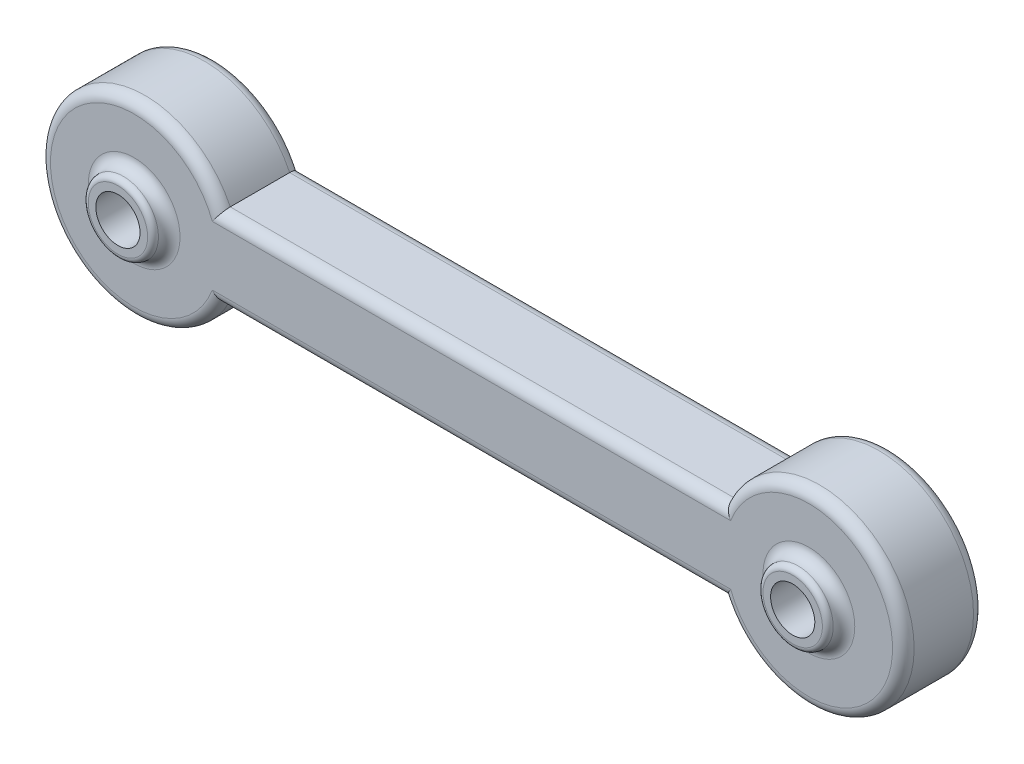
from build123d import *
from build123d.topology import SkipClean

# Parameters (mm, degrees)
SKETCH1_R            = 4.1
BOSS_EXTRUDE1_DEPTH  = 15
BOSS_EXTRUDE2_START  = -3
SKETCH2_R            = 6.5
SKETCH2_R_2          = 4.1
BOSS_EXTRUDE2_DEPTH  = 3
FILLET2_R            = 1
FILLET2_OF_MIRROR1_R = 1
FILLET1_R            = 2


# Read off the part's stored shape, not the designer's step: Mirror2
with BuildPart() as part:
    # Sketch1 → Boss-Extrude1 (new body)
    with BuildSketch(Plane.XY):
        with BuildLine():
            Line((-46.688611699, -7.5), (46.688611699, -7.5))
            ThreePointArc((46.688611699, -7.5), (80, 0), (46.688611699, 7.5))
            Line((46.688611699, 7.5), (-46.688611699, 7.5))
            ThreePointArc((-46.688611699, 7.5), (-80, 0), (-46.688611699, -7.5))
        make_face()
        with Locations((62.5, 0)):
            Circle(SKETCH1_R, mode=Mode.SUBTRACT)
        with Locations((-62.5, 0)):
            Circle(SKETCH1_R, mode=Mode.SUBTRACT)
    extrude(amount=BOSS_EXTRUDE1_DEPTH)

    # Sketch2 → Boss-Extrude2 (add)
    with BuildSketch(Plane.XY.offset(BOSS_EXTRUDE2_START)):
        with Locations((62.5, 0)):
            Circle(SKETCH2_R)
        with Locations((62.5, 0)):
            Circle(SKETCH2_R_2, mode=Mode.SUBTRACT)
    boss_extrude2 = extrude(amount=BOSS_EXTRUDE2_DEPTH)

    # Fillet2
    fillet2_edges = [part.edges().sort_by_distance(p)[0] for p in [
        (56, 0, -3),
    ]]
    fillet(fillet2_edges, radius=FILLET2_R)

    # Mirror1: Boss-Extrude2 across plane
    with SkipClean():  # the faces are left unmerged after this step: merging them gives an invalid solid
        add(boss_extrude2.mirror(Plane(origin=(0, 0, 0), x_dir=(0, 0, 1), z_dir=(1, 0, 0))))

    # Fillet2 of Mirror1
    fillet2_of_mirror1_edges = [part.edges().sort_by_distance(p)[0] for p in [
        (-56, 0, -3),
    ]]
    fillet(fillet2_of_mirror1_edges, radius=FILLET2_OF_MIRROR1_R)

    # Mirror2 outline → Mirror2 (revolve)
    with SkipClean():  # the faces are left unmerged after this step: merging them gives an invalid solid
        with BuildSketch(Plane(origin=(62.5, 0, 0), x_dir=(1, 0, 0), z_dir=(0, -1, 0))):
            with BuildLine():
                Line((6.5, 15), (6.5, 17))
                ThreePointArc((6.5, 17), (6.207106781, 17.707106781), (5.5, 18))
                Line((5.5, 18), (4.1, 18))
                Line((4.1, 18), (4.1, 15))
                Line((4.1, 15), (6.5, 15))
            make_face()
        revolve(axis=Axis((62.5, 0, 0), (0, 0, 1)))
    add(part.part.scale(1), mode=Mode.REPLACE)  # the faces are merged on a copy

    # Mirror2 2 outline → Mirror2 2 (revolve)
    with BuildSketch(Plane(origin=(-62.5, 0, 0), x_dir=(1, 0, 0), z_dir=(0, -1, 0))):
        with BuildLine():
            Line((6.5, 15), (6.5, 17))
            ThreePointArc((6.5, 17), (6.207106781, 17.707106781), (5.5, 18))
            Line((5.5, 18), (4.1, 18))
            Line((4.1, 18), (4.1, 15))
            Line((4.1, 15), (6.5, 15))
        make_face()
    revolve(axis=Axis((-62.5, 0, 0), (0, 0, 1)))

    # Fillet1
    fillet1_edges = [part.edges().sort_by_distance(p)[0] for p in [
        (80, 0, 15),
        (0, 7.5, 15),
        (56, 0, 0),
        (-56, 0, 0),
        (-80, 0, 15),
        (56, 0, 15),
        (0, 7.5, 0),
        (80, 0, 0),
        (-69, 0, 15),
        (0, -7.5, 0),
        (-80, 0, 0),
        (0, -7.5, 15),
    ]]
    fillet(fillet1_edges, radius=FILLET1_R - 0.0001)  # a hair under: the kernel refuses the full size


solid = part.part
